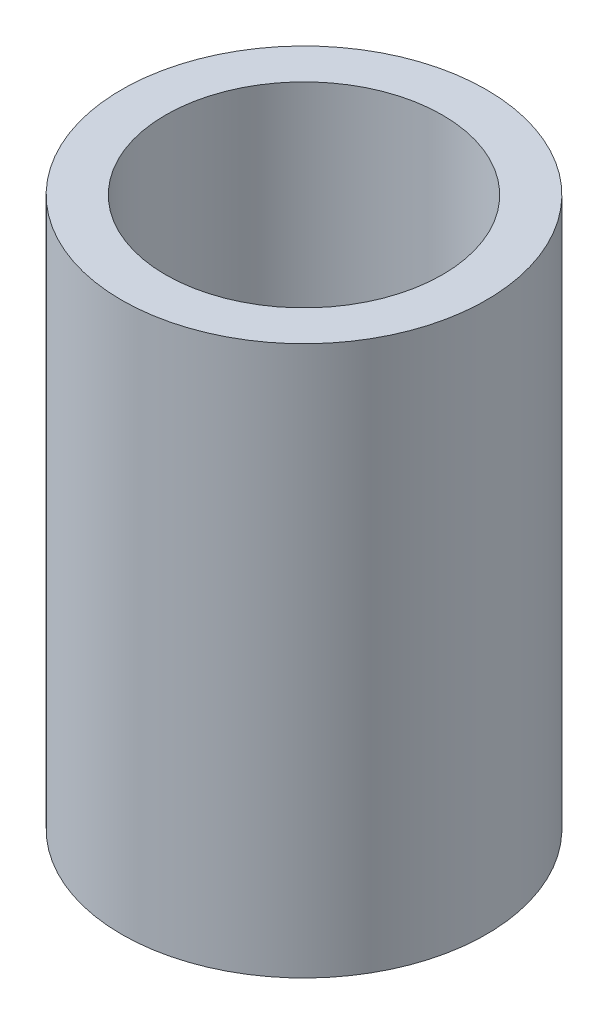
from build123d import *

# Parameters (mm, degrees)
SKETCH1_R           = 5.27
SKETCH1_R_2         = 4
BOSS_EXTRUDE1_DEPTH = 15.875


with BuildPart() as part:
    # Sketch1 → Boss-Extrude1 (new body)
    with BuildSketch(Plane(origin=(0, 0, 0), x_dir=(1, 0, 0), z_dir=(0, 1, 0))):
        Circle(SKETCH1_R)
        Circle(SKETCH1_R_2, mode=Mode.SUBTRACT)
    extrude(amount=BOSS_EXTRUDE1_DEPTH)


solid = part.part
